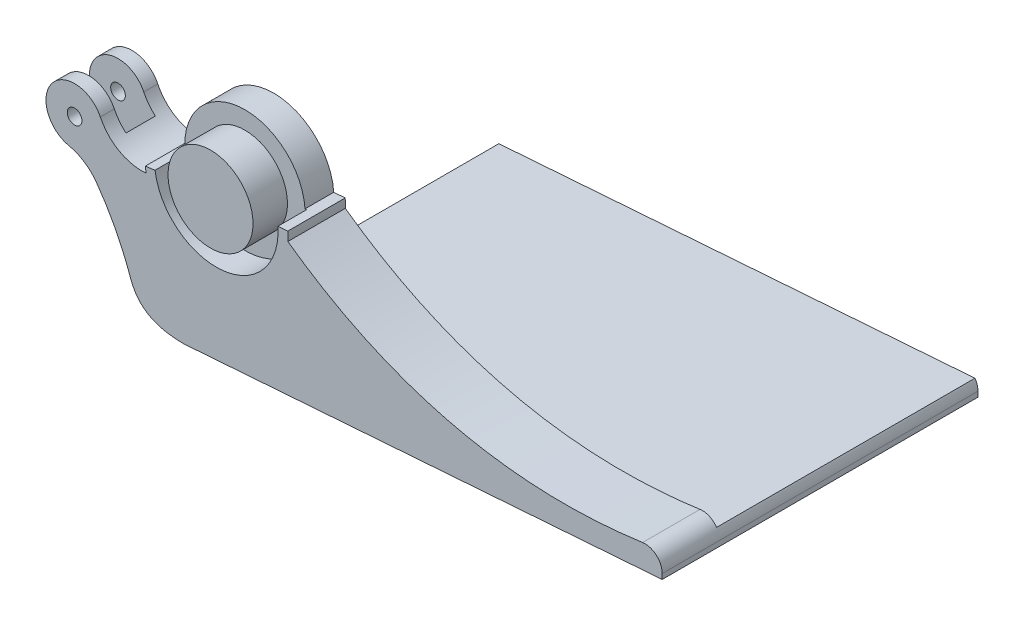
from build123d import *

# Parameters (mm, degrees)
BOSS_EXTRUDE1_DEPTH      = 2.54
BOSS_EXTRUDE1_DEPTH_BACK = 12.7
SKETCH1_R                = 18.796
SKETCH2_R                = 18.796
BOSS_EXTRUDE2_DEPTH      = 12.7
BOSS_EXTRUDE3_DEPTH      = 12.7
BOSS_EXTRUDE5_DEPTH      = 12.7
BOSS_EXTRUDE6_DEPTH      = 12.7
SKETCH7_R                = 18.796
BOSS_EXTRUDE7_DEPTH      = 12.7
BOSS_EXTRUDE8_DEPTH      = 25.4
SKETCH11_R               = 12.652854813
BOSS_EXTRUDE10_DEPTH     = 25.4
SKETCH12_R               = 3.250000001
CUT_EXTRUDE2_DEPTH       = 512.464850261
FILLET1_R                = 20.32
BOSS_EXTRUDE11_START     = 114.3
BOSS_EXTRUDE11_DEPTH     = 114.3
SKETCH16_W               = 13.01344698
SKETCH16_H               = 28.816569003
CUT_EXTRUDE4_DEPTH       = 54.61


with BuildPart() as part:
    # Sketch1 → Boss-Extrude1 (new, two sides: drawn at the far end of the back side and taken through both)
    with BuildSketch(Plane.XY.offset(-BOSS_EXTRUDE1_DEPTH_BACK)):
        with Locations((0, -407.299625141)):
            Circle(SKETCH1_R)
    extrude(amount=BOSS_EXTRUDE1_DEPTH + BOSS_EXTRUDE1_DEPTH_BACK)



with BuildPart() as body_2:
    # Sketch2 → Boss-Extrude2 (new body)
    with BuildSketch(Plane(origin=(0, 0, -12.7), x_dir=(-1, 0, 0), z_dir=(0, 0, -1))):
        with BuildLine():
            Line((-26.564149005, -405.379934257), (-31.63093582, -405.013776678))
            ThreePointArc((-31.63093582, -405.013776678), (-3.317825996, -438.839016934), (31.414187958, -411.645887785))
            Line((31.414187958, -411.645887785), (26.382120799, -410.949683715))
            ThreePointArc((26.382120799, -410.949683715), (2.786361575, -380.812356225), (-26.564149005, -405.379934257))
        make_face()
        with Locations(Location((0, -407.299625141, 0), (0, 0, 180))):
            Circle(SKETCH2_R, mode=Mode.SUBTRACT)
    extrude(amount=BOSS_EXTRUDE2_DEPTH)

    # Sketch3 → Boss-Extrude3 (add)
    with BuildSketch(Plane(origin=(0, 0, -25.4), x_dir=(-1, 0, 0), z_dir=(0, 0, -1))):
        with BuildLine():
            Line((14.213346722, -471.208070579), (-197.266538305, -455.67583119))
            Line((-197.266538305, -455.67583119), (-197.266538305, -453.387916788))
            ThreePointArc((-197.266538305, -453.387916788), (-194.645764338, -447.637078669), (-188.586186842, -445.842053367))
            add(Edge.make_bspline(
                [(-31.668722049, -408.98285055), (-77.209858947, -441.706865094), (-129.780268895, -454.105513447), (-188.586186842, -445.842053367)],
                knots=[0, 0, 0, 0, 0.953344593, 0.953344593, 0.953344593, 0.953344593], degree=3))
            ThreePointArc((-31.668722049, -408.98285055), (-2.599324763, -438.906344597), (30.96823039, -414.134090044))
            add(Edge.make_bspline(
                [(30.96823039, -414.134090044), (32.649949124, -424.470701531), (41.040109499, -436.729451805), (38.639174938, -461.09372409), (31.686044055, -471.208070579), (14.213346722, -471.208070579)],
                knots=[0, 0, 0, 0, 0.443747805, 0.572878395, 1, 1, 1, 1], degree=3))
        make_face()
    extrude(amount=-BOSS_EXTRUDE3_DEPTH)

    # Sketch5 → Boss-Extrude5 (add)
    with BuildSketch(Plane.XY.offset(-12.7)):
        with BuildLine():
            Line((31.63093582, -405.013776678), (27.278929363, -405.328279775))
            ThreePointArc((27.278929363, -405.328279775), (2.861336178, -434.499605748), (-27.092003196, -411.047898425))
            Line((-27.092003196, -411.047898425), (-31.414187958, -411.645887785))
            ThreePointArc((-31.414187958, -411.645887785), (3.317825996, -438.839016934), (31.63093582, -405.013776678))
        make_face()
    extrude(amount=BOSS_EXTRUDE5_DEPTH)

    # Sketch6 → Boss-Extrude6 (add)
    with BuildSketch(Plane.XY.offset(-12.7)):
        with BuildLine():
            Line((-14.213346722, -471.208070579), (197.266538305, -455.67583119))
            Line((197.266538305, -455.67583119), (197.266538305, -453.387916788))
            ThreePointArc((197.266538305, -453.387916788), (194.645764338, -447.637078669), (188.586186842, -445.842053367))
            add(Edge.make_bspline(
                [(188.586186842, -445.842053367), (129.780268895, -454.105513447), (77.209858947, -441.706865094), (31.668722049, -408.98285055)],
                knots=[0, 0, 0, 0, 0.953344593, 0.953344593, 0.953344593, 0.953344593], degree=3))
            ThreePointArc((31.668722049, -408.98285055), (2.599324763, -438.906344597), (-30.96823039, -414.134090044))
            add(Edge.make_bspline(
                [(-30.96823039, -414.134090044), (-32.649949124, -424.470701531), (-41.040109499, -436.729451805), (-38.639174938, -461.09372409), (-31.686044055, -471.208070579), (-14.213346722, -471.208070579)],
                knots=[0, 0, 0, 0, 0.443747805, 0.572878395, 1, 1, 1, 1], degree=3))
        make_face()
    extrude(amount=BOSS_EXTRUDE6_DEPTH)


with BuildPart() as part_1:
    add(part.part)

    add(body_2.part)  # Boss-Extrude7 merges body 2
    # Sketch7 → Boss-Extrude7 (add)
    with BuildSketch(Plane(origin=(0, 0, -12.7), x_dir=(-1, 0, 0), z_dir=(0, 0, -1))):
        with Locations(Location((0, -407.299625141, 0), (0, 0, 180))):
            Circle(SKETCH7_R)
    extrude(amount=BOSS_EXTRUDE7_DEPTH)

    # Sketch8 → Boss-Extrude8 (add)
    with BuildSketch(Plane.XY):
        with BuildLine():
            ThreePointArc((-58.391711784, -403.636078411), (-67.121824198, -403.800195984), (-67.358685042, -412.528637671))
            add(Edge.make_bspline(
                [(-37.899374688, -457.862620823), (-44.280461027, -439.825230998), (-54.11365555, -424.711188181), (-67.358685042, -412.528637671)],
                knots=[0, 0, 0, 0, 0.648412371, 0.648412371, 0.648412371, 0.648412371], degree=3))
            add(Edge.make_bspline(
                [(-30.96823039, -414.134090044), (-32.649949124, -424.470701531), (-41.040109499, -436.729451805), (-39.512215319, -452.234259992), (-38.376068735, -456.515151772), (-37.899374688, -457.862620823)],
                knots=[0, 0, 0, 0, 0.443747805, 0.572878395, 0.636374771, 0.636374771, 0.636374771, 0.636374771], degree=3))
            add(Edge.make_bspline(
                [(-30.96823039, -414.134090044), (-41.722283963, -415.45839081), (-50.863444428, -411.959053599), (-58.391711784, -403.636078411)],
                knots=[0, 0, 0, 0, 0.680532916, 0.680532916, 0.680532916, 0.680532916], degree=3))
        make_face()
    extrude(amount=-BOSS_EXTRUDE8_DEPTH)

    # Sketch11 → Boss-Extrude10 (add)
    with BuildSketch(Plane.XY):
        with Locations((-62.670851235, -408.28841522)):
            Circle(SKETCH11_R)
    extrude(amount=-BOSS_EXTRUDE10_DEPTH)

    # Sketch12 → Cut-Extrude2 (cut, through all)
    with BuildSketch(Plane.XY):
        with Locations((-62.670851235, -408.28841522)):
            Circle(SKETCH12_R)
    extrude(amount=-CUT_EXTRUDE2_DEPTH, mode=Mode.SUBTRACT)

    # Fillet1
    # the kernel refuses this fillet: 20.32 mm, written as the material it adds along each edge
    with BuildSketch(Plane(origin=(-59.511042023, -420.540367745, -25.4), x_dir=(-0.9997641834800511, -0.021715833635081266, 0), z_dir=(0, 0, 1))) as fillet1_piece_1:
        with BuildLine():
            CenterArc((10.432056933, 19.781724025), FILLET1_R, 214.575044889, 42.207687895)
            Line((-6.299098106, 8.250425267), (-6.633721207, 8.019799292))
            ThreePointArc((-6.633721207, 8.019799292), (-3.573104641, 3.801857042), (-0.310609577, -0.26207375))
            Line((-0.310609577, -0.26207375), (0.09292103, -0.395634481))
            ThreePointArc((0.09292103, -0.395634481), (2.893002714, -0.07122639), (5.693084398, -0.395634481))
            Line((5.693084398, -0.395634481), (5.786005428, 0))
        make_face()
    extrude(amount=25.4)
    with BuildSketch(Plane(origin=(-50.199792551, -410.425569918, -25.4), x_dir=(0.981910282713407, -0.18934676311381016, 0), z_dir=(0, 0, 1))) as fillet1_piece_2:
        with BuildLine():
            CenterArc((13.766955548, 19.469018818), FILLET1_R, 216.757393509, 69.882984253)
            Line((-2.512952914, 7.308962056), (-2.838551084, 7.065760921))
            ThreePointArc((-2.838551084, 7.065760921), (-1.069058095, 3.718918839), (-0.406312291, -0.008442875))
            Line((-0.406312291, -0.008442875), (-0.135668955, -0.383086015))
            ThreePointArc((-0.135668955, -0.383086015), (9.809532931, -2.061533892), (19.702243107, -0.389380376))
            Line((19.702243107, -0.389380376), (19.58586492, 0))
        make_face()
    extrude(amount=25.4)

    # Sketch15 → Boss-Extrude11 (add)
    with BuildSketch(Plane(origin=(0, 0, -25.4), x_dir=(-1, 0, 0), z_dir=(0, 0, -1)).offset(BOSS_EXTRUDE11_START)):
        with BuildLine():
            Line((-197.266538305, -455.67583119), (14.213346722, -471.208070579))
            Line((14.213346722, -471.208070579), (14.702923537, -464.542216029))
            Line((14.702923537, -464.542216029), (-195.926737542, -449.072421737))
            ThreePointArc((-195.926737542, -449.072421737), (-196.923883913, -451.12857155), (-197.266538305, -453.387916788))
            Line((-197.266538305, -453.387916788), (-197.266538305, -455.67583119))
        make_face()
    extrude(amount=-BOSS_EXTRUDE11_DEPTH)

    # Sketch16 → Cut-Extrude4 (cut)
    with BuildSketch(Plane(origin=(-100.744249605, 0, 0), x_dir=(0, 0, -1), z_dir=(1, 0, 0))):
        with Locations((12.7, -408.663339092)):
            Rectangle(SKETCH16_W, SKETCH16_H)
    extrude(amount=CUT_EXTRUDE4_DEPTH, mode=Mode.SUBTRACT)


solid = part_1.part
